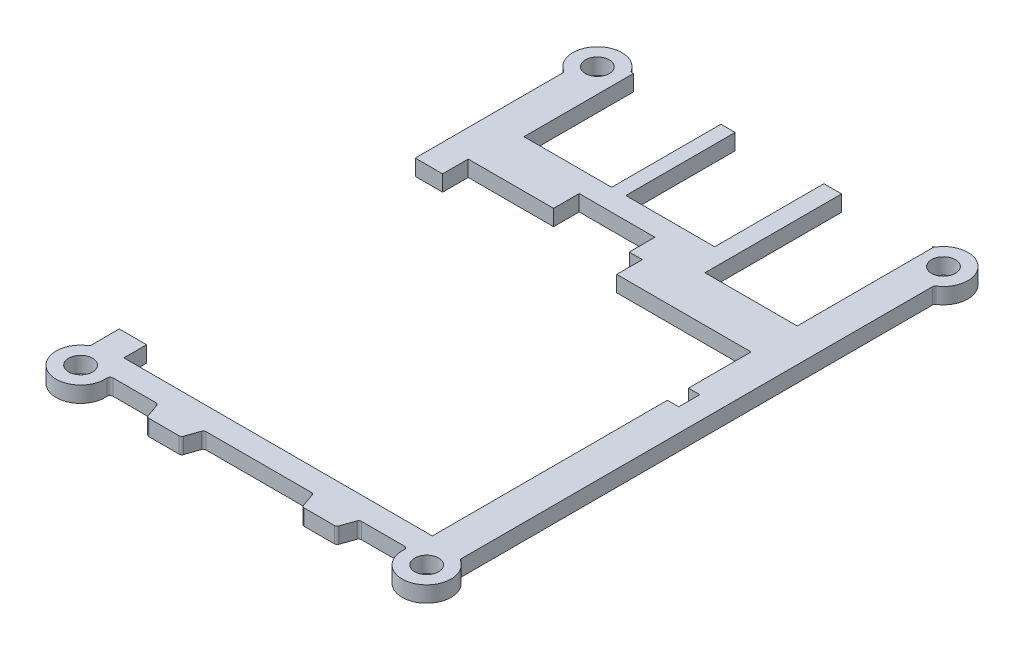
from build123d import *

# Parameters (mm, degrees)
BASEPLATE_OUTLINE_R = 2.1
BASEPLATE_DEPTH     = 2.8
CUT_EXTRUDE1_REACH  = 115.438
SKETCH3_W           = 15.4
SKETCH3_H           = 19.2
SKETCH3_W_2         = 15.6
SKETCH3_W_3         = 16.2
SKETCH3_H_2         = 24


# Read off the part's stored shape, not the designer's step: BasePlate
with BuildPart() as part:
    # BasePlate outline → BasePlate (new body)
    with BuildSketch(Plane(origin=(0, 0, 0), x_dir=(1, 0, 0), z_dir=(0, 1, 0))):
        with BuildLine():
            Line((43.502626614, -5.852332608), (48.792614178, -5.852332608))
            ThreePointArc((48.792614178, -5.852332608), (49.082078508, -5.760021707), (49.264659986, -5.517174213))
            Line((49.264659986, -5.517174213), (50.078201202, -3.187491002))
            ThreePointArc((50.078201202, -3.187491002), (50.26078268, -2.944643509), (50.55024701, -2.852332608))
            Line((50.55024701, -2.852332608), (58.116695703, -2.852332608))
            ThreePointArc((58.116695703, -2.852332608), (58.484685739, -3.013831008), (58.614956567, -3.393999275))
            ThreePointArc((58.614956567, -3.393999275), (64.799237397, -7.61016844), (65.229166667, -0.137781095))
            ThreePointArc((65.229166667, -0.137781095), (65.061014427, 0.043158816), (65, 0.282515593))
            Line((65, 0.282515593), (65, 83.012819192))
            ThreePointArc((65, 83.012819192), (65.061014427, 83.252175969), (65.229166667, 83.433115879))
            ThreePointArc((65.229166667, 83.433115879), (65.940559159, 90.088226551), (59.285448487, 89.376834059))
            ThreePointArc((59.285448487, 89.376834059), (59.104508577, 89.208681819), (58.8651518, 89.147667392))
            Line((58.8651518, 89.147667392), (6.1348482, 89.147667392))
            ThreePointArc((6.1348482, 89.147667392), (5.895491423, 89.208681819), (5.714551513, 89.376834059))
            ThreePointArc((5.714551513, 89.376834059), (-0.940559159, 90.088226551), (-0.229166667, 83.433115879))
            ThreePointArc((-0.229166667, 83.433115879), (-0.061014427, 83.252175969), (0, 83.012819192))
            Line((0, 83.012819192), (0, 0.282515593))
            ThreePointArc((0, 0.282515593), (-0.061014427, 0.043158816), (-0.229166667, -0.137781095))
            ThreePointArc((-0.229166667, -0.137781095), (0.200762603, -7.61016844), (6.385043433, -3.393999275))
            ThreePointArc((6.385043433, -3.393999275), (6.515314261, -3.013831008), (6.883304297, -2.852332608))
            Line((6.883304297, -2.852332608), (14.44975299, -2.852332608))
            ThreePointArc((14.44975299, -2.852332608), (14.73921732, -2.944643509), (14.921798798, -3.187491002))
            Line((14.921798798, -3.187491002), (15.735340014, -5.517174213))
            ThreePointArc((15.735340014, -5.517174213), (15.917921492, -5.760021707), (16.207385822, -5.852332608))
            Line((16.207385822, -5.852332608), (21.497373386, -5.852332608))
            ThreePointArc((21.497373386, -5.852332608), (21.786837716, -5.760021707), (21.969419194, -5.517174213))
            Line((21.969419194, -5.517174213), (22.78296041, -3.187491002))
            ThreePointArc((22.78296041, -3.187491002), (22.965541888, -2.944643509), (23.255006218, -2.852332608))
            Line((23.255006218, -2.852332608), (41.744993782, -2.852332608))
            ThreePointArc((41.744993782, -2.852332608), (42.034458112, -2.944643509), (42.21703959, -3.187491002))
            Line((42.21703959, -3.187491002), (43.030580806, -5.517174213))
            ThreePointArc((43.030580806, -5.517174213), (43.213162284, -5.760021707), (43.502626614, -5.852332608))
        make_face()
        with Locations((2.1, -3.752332608)):
            Circle(BASEPLATE_OUTLINE_R, mode=Mode.SUBTRACT)
        with Locations((62.9, -3.752332608)):
            Circle(BASEPLATE_OUTLINE_R, mode=Mode.SUBTRACT)
        with Locations((2.1, 87.047667392)):
            Circle(BASEPLATE_OUTLINE_R, mode=Mode.SUBTRACT)
        with Locations((62.9, 87.047667392)):
            Circle(BASEPLATE_OUTLINE_R, mode=Mode.SUBTRACT)
    extrude(amount=BASEPLATE_DEPTH)

    # Sketch3 → Cut-Extrude1 (cut, up to next)
    with BuildSketch(Plane(origin=(0, 2.8, 0), x_dir=(1, 0, 0), z_dir=(0, 1, 0)), mode=Mode.PRIVATE) as cut_extrude1_sk1:
        Polygon((4.8, 1.147667392), (59, 1.147667392), (59, 42.447667392), (61, 42.447667392), (61, 46.147667392), (59, 46.147667392), (59, 57.147667392), (35.4, 57.147667392), (35.4, 61.647667392), (33.1, 61.647667392), (33.1, 66.147667392), (19.8, 66.147667392), (19.8, 61.647667392), (4.8, 61.647667392), (4.8, 57.147667392), (0, 57.147667392), (0, 5.147667392), (4.8, 5.147667392), align=None)
    cut_extrude1_tool1 = extrude(cut_extrude1_sk1.sketch, amount=-CUT_EXTRUDE1_REACH, mode=Mode.PRIVATE) & part.part
    # Sketch3 → Cut-Extrude1 (cut, up to next)
    with BuildSketch(Plane(origin=(0, 2.8, 0), x_dir=(1, 0, 0), z_dir=(0, 1, 0)), mode=Mode.PRIVATE) as cut_extrude1_sk2:
        with Locations((14, 79.547667392)):
            Rectangle(SKETCH3_W, SKETCH3_H)
    cut_extrude1_tool2 = extrude(cut_extrude1_sk2.sketch, amount=-CUT_EXTRUDE1_REACH, mode=Mode.PRIVATE) & part.part
    # Sketch3 → Cut-Extrude1 (cut, up to next)
    with BuildSketch(Plane(origin=(0, 2.8, 0), x_dir=(1, 0, 0), z_dir=(0, 1, 0)), mode=Mode.PRIVATE) as cut_extrude1_sk3:
        with Locations((32, 79.547667392)):
            Rectangle(SKETCH3_W_2, SKETCH3_H)
    cut_extrude1_tool3 = extrude(cut_extrude1_sk3.sketch, amount=-CUT_EXTRUDE1_REACH, mode=Mode.PRIVATE) & part.part
    # Sketch3 → Cut-Extrude1 (cut, up to next)
    with BuildSketch(Plane(origin=(0, 2.8, 0), x_dir=(1, 0, 0), z_dir=(0, 1, 0)), mode=Mode.PRIVATE) as cut_extrude1_sk4:
        with Locations((51, 77.147667392)):
            Rectangle(SKETCH3_W_3, SKETCH3_H_2)
    cut_extrude1_tool4 = extrude(cut_extrude1_sk4.sketch, amount=-CUT_EXTRUDE1_REACH, mode=Mode.PRIVATE) & part.part
    add(cut_extrude1_tool1.solids().sort_by_distance((29.290557, 2.8, -31.112428))[0], mode=Mode.SUBTRACT)
    add(cut_extrude1_tool2.solids().sort_by_distance((14, 2.8, -79.547667))[0], mode=Mode.SUBTRACT)
    add(cut_extrude1_tool3.solids().sort_by_distance((32, 2.8, -79.547667))[0], mode=Mode.SUBTRACT)
    add(cut_extrude1_tool4.solids().sort_by_distance((51, 2.8, -77.147667))[0], mode=Mode.SUBTRACT)


solid = part.part
